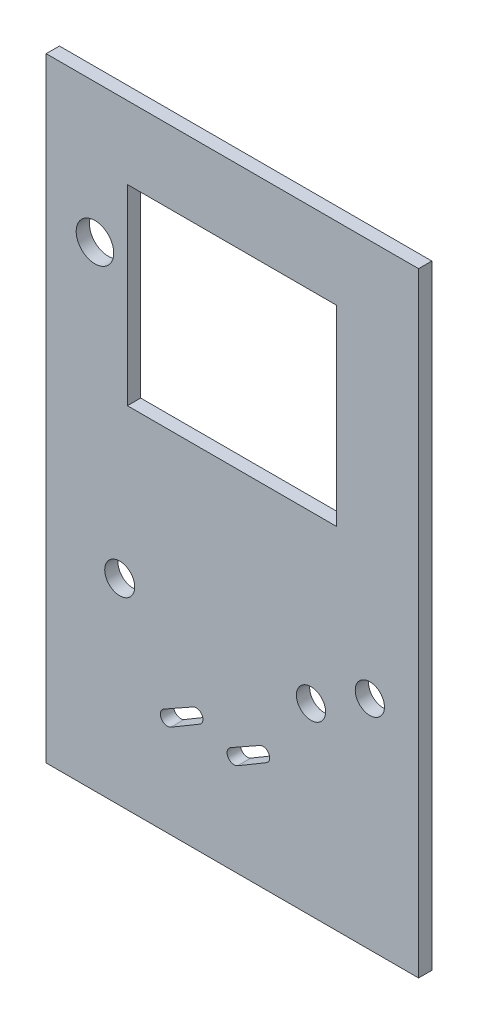
from build123d import *

# Parameters (mm, degrees)
SKETCH1_6_W = 50.090098238
SKETCH1_6_H = 45.932062837
SKETCH1_6_R = 4.5
BEZEL_DEPTH = 3.18
SKETCH1_W   = 89.29
SKETCH1_H   = 147.294272307
SKETCH1_R   = 3.6
SKETCH1_R_2 = 3.5
BODY_DEPTH  = 3.18


with BuildPart() as part:
    # Sketch1<6> → Bezel (new body)
    with BuildSketch(Plane.XY):
        with BuildLine():
            ThreePointArc((38.389642662, 59.990077479), (37.657409615, 61.757844432), (35.889642662, 62.490077479))
            Line((35.889642662, 62.490077479), (-35.919151108, 62.490077479))
            ThreePointArc((-35.919151108, 62.490077479), (-37.686918061, 61.757844432), (-38.419151108, 59.990077479))
            Line((-38.419151108, 59.990077479), (-38.419151108, 6.918014642))
            ThreePointArc((-38.419151108, 6.918014642), (-37.686918061, 5.150247689), (-35.919151108, 4.418014642))
            Line((-35.919151108, 4.418014642), (29.997375098, 4.418014642))
            ThreePointArc((29.997375098, 4.418014642), (35.990372343, 7.41277043), (38.389642662, 13.668014642))
            Line((38.389642662, 13.668014642), (38.389642662, 59.990077479))
        make_face()
        with Locations((-0.014754223, 33.23404606)):
            Rectangle(SKETCH1_6_W, SKETCH1_6_H, mode=Mode.SUBTRACT)
        with Locations((-32.845865367, 40.325993685)):
            Circle(SKETCH1_6_R, mode=Mode.SUBTRACT)
    extrude(amount=BEZEL_DEPTH)

    # Sketch1 → Body (add)
    with BuildSketch(Plane.XY):
        with Locations((0.105848892, -0.017058674)):
            Rectangle(SKETCH1_W, SKETCH1_H)
        with BuildLine():
            ThreePointArc((-14.641551271, -51.285483428), (-16.940439708, -50.641794665), (-16.296750946, -48.342906228))
            Line((-16.296750946, -48.342906228), (-9.324146649, -44.420816311))
            ThreePointArc((-9.324146649, -44.420816311), (-7.152105158, -45.022980632), (-7.741744524, -47.198455643))
            Line((-7.741744524, -47.198455643), (-14.641551271, -51.285483428))
        make_face(mode=Mode.SUBTRACT)
        with Locations((-26.900831216, -26.517202566)):
            Circle(SKETCH1_R, mode=Mode.SUBTRACT)
        with BuildLine():
            ThreePointArc((1.358448729, -51.285483428), (-0.940439708, -50.641794665), (-0.296750946, -48.342906228))
            Line((-0.296750946, -48.342906228), (6.675853351, -44.420816311))
            ThreePointArc((6.675853351, -44.420816311), (8.847894842, -45.022980632), (8.258255476, -47.198455643))
            Line((8.258255476, -47.198455643), (1.358448729, -51.285483428))
        make_face(mode=Mode.SUBTRACT)
        with Locations((18.957561099, -29.561304194)):
            Circle(SKETCH1_R_2, mode=Mode.SUBTRACT)
        with Locations((33.068305831, -21.491722051)):
            Circle(SKETCH1_R_2, mode=Mode.SUBTRACT)
        with BuildLine():
            Line((-35.919151108, 62.490077479), (35.889642662, 62.490077479))
            ThreePointArc((35.889642662, 62.490077479), (37.657409615, 61.757844432), (38.389642662, 59.990077479))
            Line((38.389642662, 59.990077479), (38.389642662, 13.668014642))
            ThreePointArc((38.389642662, 13.668014642), (35.990372343, 7.41277043), (29.997375098, 4.418014642))
            Line((29.997375098, 4.418014642), (-35.919151108, 4.418014642))
            ThreePointArc((-35.919151108, 4.418014642), (-37.686918061, 5.150247689), (-38.419151108, 6.918014642))
            Line((-38.419151108, 6.918014642), (-38.419151108, 59.990077479))
            ThreePointArc((-38.419151108, 59.990077479), (-37.686918061, 61.757844432), (-35.919151108, 62.490077479))
        make_face(mode=Mode.SUBTRACT)
    extrude(amount=BODY_DEPTH)


solid = part.part
